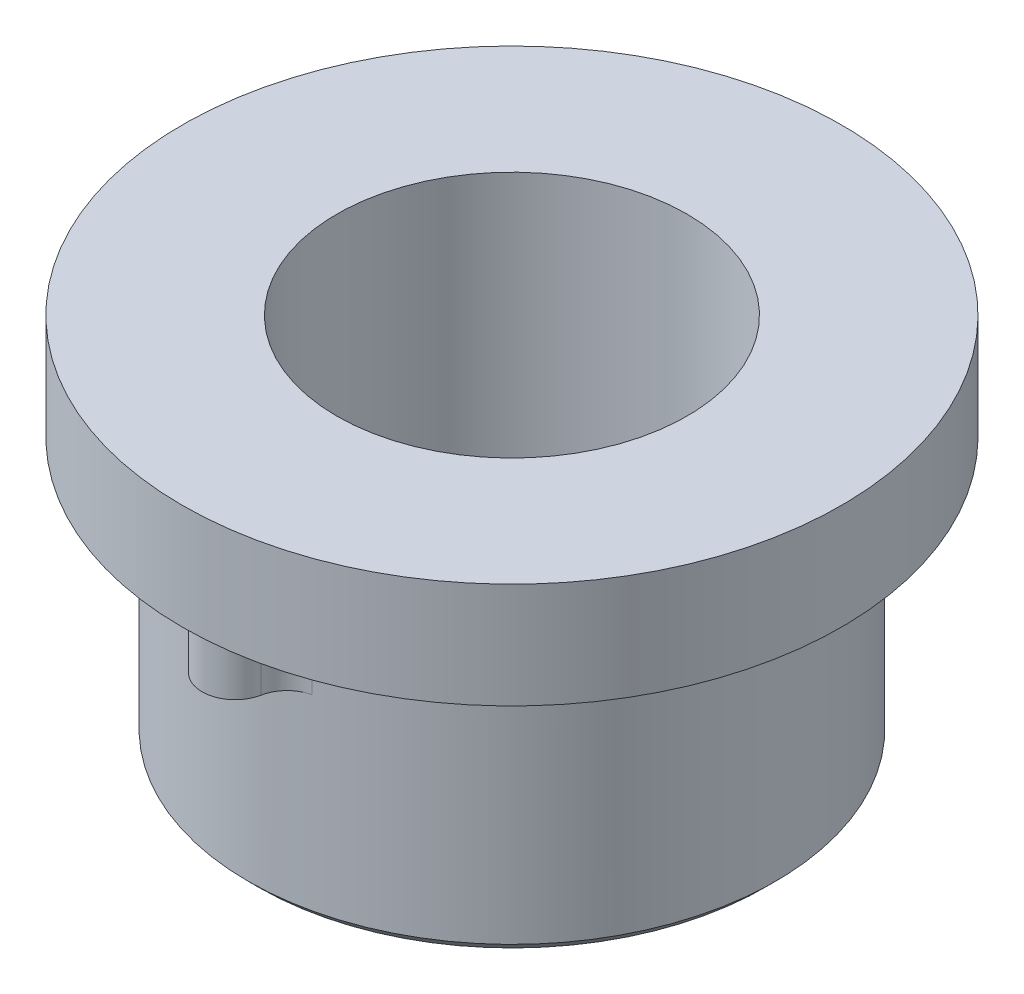
from build123d import *

# Parameters (mm, degrees)
SKETCH2_R                   = 6.35
BOSS_EXTRUDE1_DEPTH         = 6.35
SKETCH3_R                   = 7.9375
BOSS_EXTRUDE2_DEPTH         = 2.54
BOSS_EXTRUDE3_DEPTH         = 1.5875
F_3_8_24_TAPPED_HOLE1_D     = 8.4328
F_3_8_24_TAPPED_HOLE1_DEPTH = 22.352
F_3_8_24_TAPPED_HOLE1_TIP   = 2.533468714
CHAMFER1_SIZE               = 0.254
FILLET1_R                   = 0.79375


with BuildPart() as part:
    # Sketch2 → Boss-Extrude1 (new body)
    with BuildSketch(Plane(origin=(0, 0, 0), x_dir=(1, 0, 0), z_dir=(0, 1, 0))):
        with Locations(Location((0, 0, 0), (0, 0, 270))):
            Circle(SKETCH2_R)
    extrude(amount=BOSS_EXTRUDE1_DEPTH)

    # Sketch3 → Boss-Extrude2 (add)
    with BuildSketch(Plane(origin=(0, 6.35, 0), x_dir=(1, 0, 0), z_dir=(0, 1, 0))):
        with Locations(Location((0, 0, 0), (0, 0, 270))):
            Circle(SKETCH3_R)
    extrude(amount=BOSS_EXTRUDE2_DEPTH)

    # Sketch8 → Boss-Extrude3 (add)
    with BuildSketch(Plane.XZ.offset(-6.35)):
        with BuildLine():
            Line((-0.79375, -6.6675), (-0.79375, 6.6675))
            ThreePointArc((-0.79375, 6.6675), (0, 7.46125), (0.79375, 6.6675))
            Line((0.79375, 6.6675), (0.79375, -6.6675))
            ThreePointArc((0.79375, -6.6675), (0, -7.46125), (-0.79375, -6.6675))
        make_face()
    extrude(amount=BOSS_EXTRUDE3_DEPTH)

    # 3/8-24 Tapped Hole1
    with Locations(Plane(origin=(0, 8.89, 0), x_dir=(-1, 0, 0), z_dir=(0, 1, 0))):
        with Locations((0, 0)):
            Hole(F_3_8_24_TAPPED_HOLE1_D / 2, depth=F_3_8_24_TAPPED_HOLE1_DEPTH)
            with Locations((0, 0, -(F_3_8_24_TAPPED_HOLE1_DEPTH + F_3_8_24_TAPPED_HOLE1_TIP / 2))):  # 118° drill point
                Cone(0, F_3_8_24_TAPPED_HOLE1_D / 2, F_3_8_24_TAPPED_HOLE1_TIP, mode=Mode.SUBTRACT)

    # Chamfer1
    chamfer1_edges = [part.edges().sort_by_distance(p)[0] for p in [
        (0, 0, -6.35),
    ]]
    chamfer(chamfer1_edges, length=CHAMFER1_SIZE)

    # Fillet1
    # the kernel refuses this fillet: 0.79375 mm, written as the material it adds along each edge
    with BuildSketch(Plane(origin=(0.79375, 7.850289674, 6.300195309), x_dir=(0.985141793538893, 0, -0.17174296673509887), z_dir=(0, -1, 0)), Plane(origin=(-0.79375, 7.850289674, -6.300195309), x_dir=(-0.985141793538893, 0, 0.17174296673509887), z_dir=(0, -1, 0))) as fillet1_piece_1:
        with BuildLine():
            CenterArc((0.637623112, 0.792863336), FILLET1_R, 200.939239267, 66.352342207)
            Line((-0.103707592, 0.509194779), (-0.177840663, 0.480827923))
            ThreePointArc((-0.177840663, 0.480827923), (-0.141277627, 0.348215104), (-0.07819563, -0.013632098))
            Line((-0.07819563, -0.013632098), (0.003750724, -0.079286334))
            ThreePointArc((0.003750724, -0.079286334), (0.300057935, -0.072281687), (0.596365145, -0.079286334))
            Line((0.596365145, -0.079286334), (0.60011587, 0))
        make_face()
    extrude(amount=3.087789674)
    with BuildSketch(Plane(origin=(0.79375, 7.850289674, -6.300195309), x_dir=(0.985141793538893, 0, 0.17174296673509887), z_dir=(0, -1, 0)), Plane(origin=(-0.79375, 7.850289674, 6.300195309), x_dir=(-0.985141793538893, 0, -0.17174296673509887), z_dir=(0, -1, 0))) as fillet1_piece_2:
        with BuildLine():
            CenterArc((0.637623112, -0.792863336), FILLET1_R, 92.708418526, 66.352342207)
            Line((-0.103707592, -0.509194779), (-0.177840663, -0.480827923))
            ThreePointArc((-0.177840663, -0.480827923), (-0.141277627, -0.348215104), (-0.07819563, 0.013632098))
            Line((-0.07819563, 0.013632098), (0.003750724, 0.079286334))
            ThreePointArc((0.003750724, 0.079286334), (0.300057935, 0.072281687), (0.596365145, 0.079286334))
            Line((0.596365145, 0.079286334), (0.60011587, 0))
        make_face()
    extrude(amount=3.087789674)


solid = part.part
